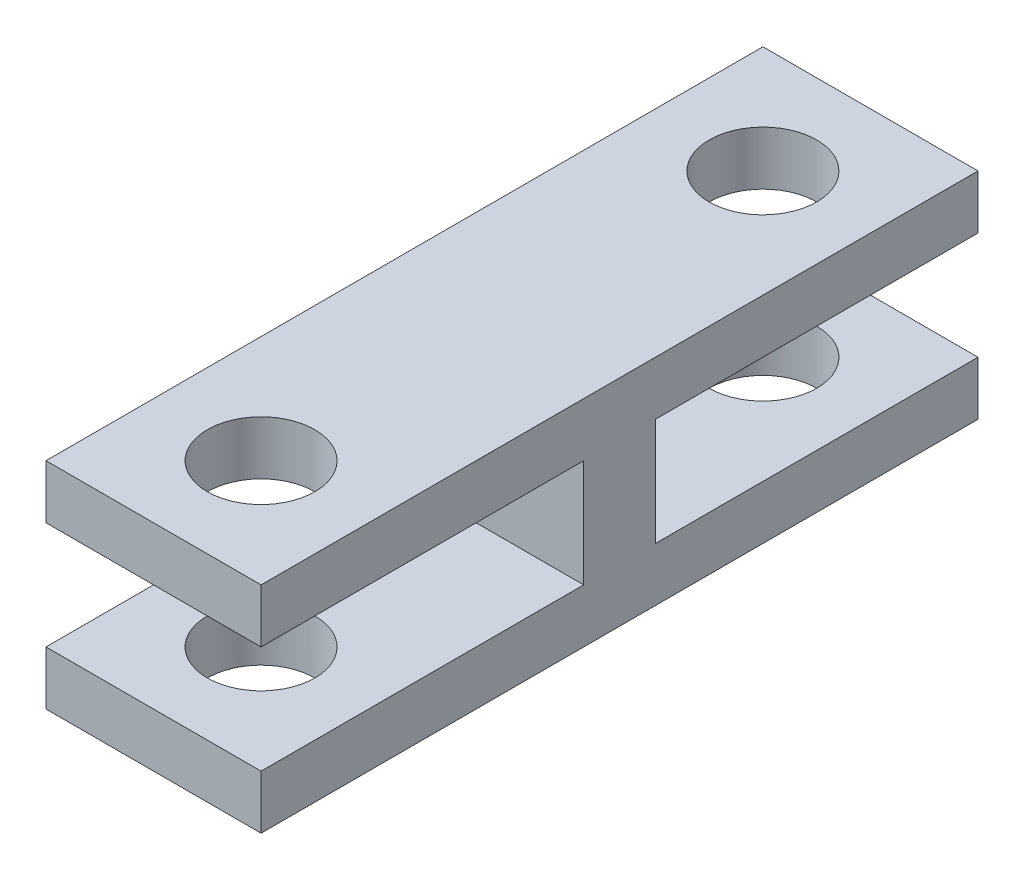
from build123d import *

# Parameters (mm, degrees)
BOSS_EXTRUDE1_DEPTH = 6
SKETCH2_R           = 1.5
CUT_EXTRUDE1_DEPTH  = 18.598835131


with BuildPart() as part:
    # Sketch1 → Boss-Extrude1 (new body)
    with BuildSketch(Plane(origin=(0, 0, 0), x_dir=(0, 0, -1), z_dir=(1, 0, 0))):
        Polygon((-4.581861398, -8.60824031), (4.418138602, -8.60824031), (4.418138602, -5.60824031), (-4.581861398, -5.60824031), (-4.581861398, -4.10824031), (15.418138602, -4.10824031), (15.418138602, -5.60824031), (6.418138602, -5.60824031), (6.418138602, -8.60824031), (15.418138602, -8.60824031), (15.418138602, -10.10824031), (-4.581861398, -10.10824031), align=None)
    extrude(amount=BOSS_EXTRUDE1_DEPTH)

    # Sketch2 → Cut-Extrude1 (cut, through all)
    with BuildSketch(Plane(origin=(0, -4.10824031, 0), x_dir=(1, 0, 0), z_dir=(0, 1, 0))):
        with Locations((3, -1.581861398)):
            Circle(SKETCH2_R)
        with Locations((3, 12.418138602)):
            Circle(SKETCH2_R)
    extrude(amount=-CUT_EXTRUDE1_DEPTH, mode=Mode.SUBTRACT)


solid = part.part
